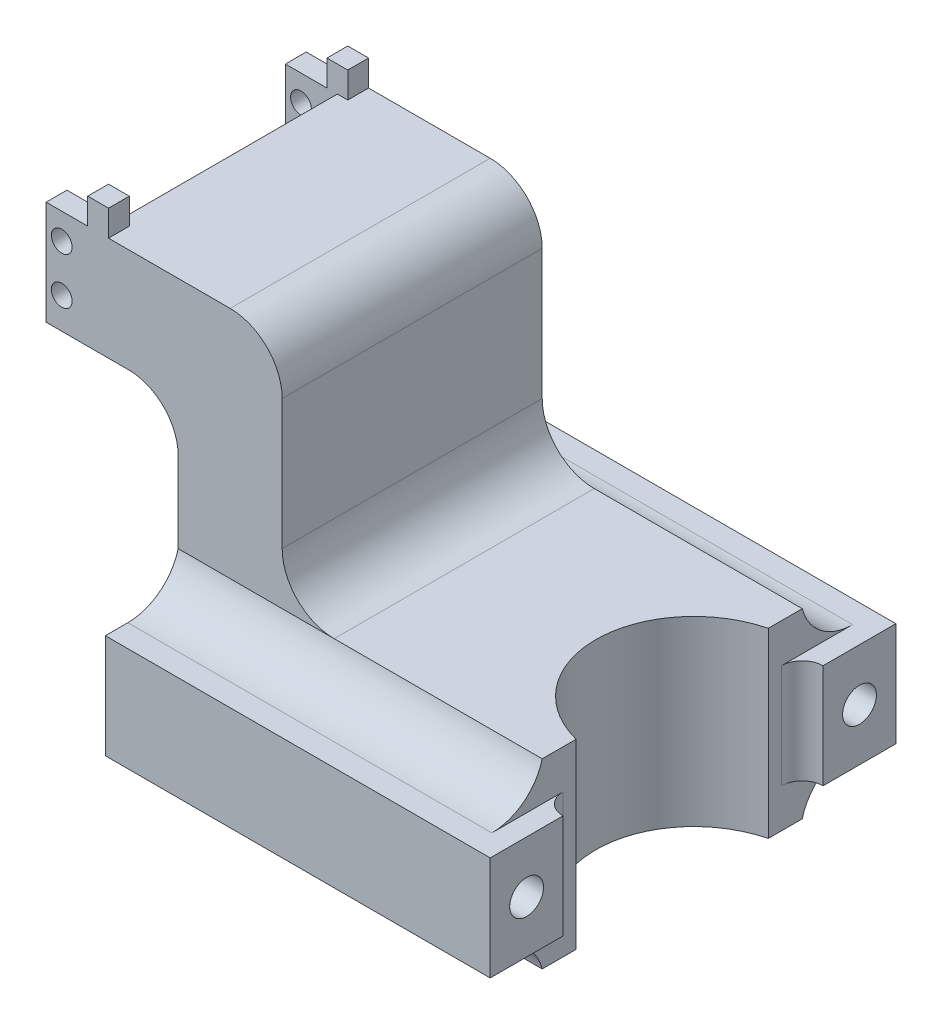
from build123d import *
from build123d.topology import SkipClean

# Parameters (mm, degrees)
SKETCH1_W                = 50
SKETCH1_H                = 50
SKETCH1_RX               = 19.7
SKETCH1_RY               = 19.1
BOSS_EXTRUDE1_DEPTH      = 35
SKETCH2_W                = 30
SKETCH2_H                = 50
CUT_EXTRUDE1_DEPTH       = 35
SKETCH3_W                = 13
SKETCH3_H                = 50
BOSS_EXTRUDE2_DEPTH      = 20
SKETCH4_R                = 1.5
CUT_EXTRUDE2_DEPTH       = 64.639610377
SKETCH5_W                = 36.974567712
SKETCH5_H                = 20
CUT_EXTRUDE3_DEPTH       = 20
BOSS_EXTRUDE3_DEPTH      = 4
BOSS_EXTRUDE3_DEPTH_BACK = 20
SKETCH6_W                = 14
SKETCH6_H                = 20
SKETCH6_R                = 3.25
SKETCH7_R                = 5.3
SKETCH7_R_2              = 3
CUT_EXTRUDE4_DEPTH       = 6
SKETCH8_W                = 13
SKETCH8_H                = 13.025432288
CUT_EXTRUDE5_DEPTH       = 30
FILLET6_R                = 4
FILLET5_R                = 10
SKETCH9_R                = 5.3
BOSS_EXTRUDE4_DEPTH      = 50
SKETCH10_W               = 20
SKETCH10_H               = 50
BOSS_EXTRUDE5_DEPTH      = 45
FILLET7_R                = 10
SKETCH11_W               = 50
SKETCH11_H               = 20
BOSS_EXTRUDE6_DEPTH      = 85
FILLET8_R                = 9.5
SKETCH13_R               = 37.5
BOSS_EXTRUDE7_DEPTH      = 20
CUT_EXTRUDE6_DEPTH       = 85
FILLET9_R                = 10
FILLET10_R               = 10
SKETCH14_R               = 3.25
CUT_EXTRUDE7_DEPTH       = 85
SKETCH15_R               = 5.3
CUT_EXTRUDE8_DEPTH       = 7
SKETCH16_R               = 3.25
BOSS_EXTRUDE9_DEPTH      = 56
SKETCH16_3_R             = 3.25
CUT_EXTRUDE11_DEPTH      = 10
SKETCH17_W               = 75
SKETCH17_H               = 20
CUT_EXTRUDE12_DEPTH      = 69.613081
SKETCH19_W               = 50
SKETCH19_H               = 20
BOSS_EXTRUDE10_DEPTH     = 10
SKETCH20_W               = 42
SKETCH20_H               = 20
CUT_EXTRUDE14_DEPTH      = 10
CUT_EXTRUDE15_REACH      = 145.435
SKETCH21_R               = 2
SKETCH22_W               = 4
SKETCH22_H               = 4
BOSS_EXTRUDE11_DEPTH     = 5
SKETCH25_R               = 2.5
CUT_EXTRUDE16_DEPTH      = 3.81


# Some blends are built 0.0001 mm under size
with BuildPart() as part:
    # Sketch1 → Boss-Extrude1 (new body)
    with BuildSketch(Plane(origin=(0, 0, 0), x_dir=(1, 0, 0), z_dir=(0, 1, 0))):
        Rectangle(SKETCH1_W, SKETCH1_H)
        with Locations((0, 0)):
            Ellipse(SKETCH1_RX, SKETCH1_RY, mode=Mode.SUBTRACT)
    extrude(amount=BOSS_EXTRUDE1_DEPTH)

    # Sketch2 → Cut-Extrude1 (cut)
    with BuildSketch(Plane(origin=(0, 35, 0), x_dir=(1, 0, 0), z_dir=(0, 1, 0))):
        with Locations((10, 0)):
            Rectangle(SKETCH2_W, SKETCH2_H)
    extrude(amount=-CUT_EXTRUDE1_DEPTH, mode=Mode.SUBTRACT)

    # Sketch3 → Boss-Extrude2 (add)
    with BuildSketch(Plane(origin=(0, 35, 0), x_dir=(1, 0, 0), z_dir=(0, 1, 0))):
        with Locations((-18.5, 0)):
            Rectangle(SKETCH3_W, SKETCH3_H)
    extrude(amount=BOSS_EXTRUDE2_DEPTH)

    # Sketch4 → Cut-Extrude2 (cut, through all)
    with BuildSketch(Plane.ZY.offset(25)):
        with Locations((18.474567712, 50)):
            Circle(SKETCH4_R)
    extrude(amount=-CUT_EXTRUDE2_DEPTH, mode=Mode.SUBTRACT)

    # Sketch5 → Cut-Extrude3 (cut)
    with BuildSketch(Plane(origin=(-12, 55, -25), x_dir=(0, 0, 1), z_dir=(-1, 0, 0))):
        with Locations((18.487283856, -10)):
            Rectangle(SKETCH5_W, SKETCH5_H)
    extrude(amount=CUT_EXTRUDE3_DEPTH, mode=Mode.SUBTRACT)

    # Sketch6 → Boss-Extrude3 (add, two sides: drawn at the far end of the back side and taken through both)
    # profile 1 of 2: a face of its own
    with BuildSketch(Plane(origin=(-5, 0, 0), x_dir=(0, 0, -1), z_dir=(1, 0, 0)).offset(-BOSS_EXTRUDE3_DEPTH_BACK)):
        with Locations((-32, 17.5)):
            Rectangle(SKETCH6_W, SKETCH6_H)
        with Locations((-32, 17.5)):
            Circle(SKETCH6_R, mode=Mode.SUBTRACT)
    # profile 2 of 2: a face of its own
    with BuildSketch(Plane(origin=(-5, 0, 0), x_dir=(0, 0, -1), z_dir=(1, 0, 0)).offset(-BOSS_EXTRUDE3_DEPTH_BACK)):
        with Locations((32, 17.5)):
            Rectangle(SKETCH6_W, SKETCH6_H)
        with Locations((32, 17.5)):
            Circle(SKETCH6_R, mode=Mode.SUBTRACT)
    extrude(amount=BOSS_EXTRUDE3_DEPTH + BOSS_EXTRUDE3_DEPTH_BACK)

    # Sketch7 → Cut-Extrude4 (cut)
    with BuildSketch(Plane.ZY.offset(25)):
        with Locations((-32, 17.5)):
            Circle(SKETCH7_R)
        with Locations((32, 17.5)):
            Circle(SKETCH7_R)
        with Locations((18.474567712, 50)):
            Circle(SKETCH7_R_2)
    extrude(amount=-CUT_EXTRUDE4_DEPTH, mode=Mode.SUBTRACT)

    # Sketch8 → Cut-Extrude5 (cut)
    with BuildSketch(Plane(origin=(0, 35, 0), x_dir=(1, 0, 0), z_dir=(0, 1, 0))):
        with Locations((-18.5, -18.487283856)):
            Rectangle(SKETCH8_W, SKETCH8_H)
    extrude(amount=CUT_EXTRUDE5_DEPTH, mode=Mode.SUBTRACT)

    # Fillet6
    fillet6_edges = [part.edges().sort_by_distance(p)[0] for p in [
        (-5, 17.5, 25),
        (-5, 17.5, -25),
    ]]
    fillet(fillet6_edges, radius=FILLET6_R - 0.0001)  # a hair under: the kernel refuses the full size

    # Fillet5
    # the kernel refuses this fillet: 10 mm, written as the material it adds along each edge
    with BuildSketch(Plane(origin=(-5, 7.5, 25), x_dir=(0, -1, 0), z_dir=(-1, 0, 0))) as fillet5_piece_1:
        with BuildLine():
            CenterArc((10, 9.682458366), FILLET5_R, 180, 75.522487814)
            Line((0, 9.682458366), (0, 0))
            Line((0, 0), (7.5, 0))
        make_face()
    extrude(amount=20)
    with BuildSketch(Plane(origin=(-5, 27.5, 25), x_dir=(0, 0, 1), z_dir=(-1, 0, 0)), Plane(origin=(-5, 7.5, -25), x_dir=(0, 0, -1), z_dir=(-1, 0, 0))) as fillet5_piece_2:
        with BuildLine():
            CenterArc((9.682458366, 10), FILLET5_R, 194.477512186, 75.522487814)
            Line((0, 7.5), (0, 0))
            Line((0, 0), (9.682458366, 0))
        make_face()
    extrude(amount=20)
    with BuildSketch(Plane(origin=(-5, 27.5, -25), x_dir=(0, 0, -1), z_dir=(-1, 0, 0))) as fillet5_piece_3:
        with BuildLine():
            CenterArc((9.682458366, -10), FILLET5_R, 90, 75.522487814)
            Line((0, -7.5), (0, 0))
            Line((0, 0), (9.682458366, 0))
        make_face()
    extrude(amount=20)

    # Sketch9 → Boss-Extrude4 (add)
    with BuildSketch(Plane.ZY.offset(25)):
        with BuildLine():
            Line((39, 27.5), (34.682458366, 27.5))
            ThreePointArc((34.682458366, 27.5), (28.558734009, 29.59430585), (25, 35))
            Line((25, 35), (-25, 35))
            ThreePointArc((-25, 35), (-28.558734009, 29.59430585), (-34.682458366, 27.5))
            Line((-34.682458366, 27.5), (-39, 27.5))
            Line((-39, 27.5), (-39, 7.5))
            Line((-39, 7.5), (-34.682458366, 7.5))
            ThreePointArc((-34.682458366, 7.5), (-28.558734009, 5.40569415), (-25, 0))
            Line((-25, 0), (25, 0))
            ThreePointArc((25, 0), (28.558734009, 5.40569415), (34.682458366, 7.5))
            Line((34.682458366, 7.5), (39, 7.5))
            Line((39, 7.5), (39, 27.5))
        make_face()
        with Locations((32, 17.5)):
            Circle(SKETCH9_R, mode=Mode.SUBTRACT)
        with Locations((-32, 17.5)):
            Circle(SKETCH9_R, mode=Mode.SUBTRACT)
    extrude(amount=BOSS_EXTRUDE4_DEPTH)

    # Sketch10 → Boss-Extrude5 (add)
    with SkipClean():  # the faces are left unmerged after this step: merging them gives an invalid solid
        with BuildSketch(Plane(origin=(0, 35, 0), x_dir=(1, 0, 0), z_dir=(0, 1, 0))):
            with Locations((-65, 0)):
                Rectangle(SKETCH10_W, SKETCH10_H)
        extrude(amount=BOSS_EXTRUDE5_DEPTH)

    # Fillet7
    fillet7_edges = [part.edges().sort_by_distance(p)[0] for p in [
        (-55, 35, 0),
    ]]
    fillet(fillet7_edges, radius=FILLET7_R)

    # Sketch11 → Boss-Extrude6 (add)
    with SkipClean():  # the faces are left unmerged after this step: merging them gives an invalid solid
        with BuildSketch(Plane.ZY.offset(75)):
            with Locations((0, 70)):
                Rectangle(SKETCH11_W, SKETCH11_H)
        extrude(amount=BOSS_EXTRUDE6_DEPTH)

    # Fillet8
    fillet8_edges = [part.edges().sort_by_distance(p)[0] for p in [
        (-75, 60, 0),
    ]]
    fillet(fillet8_edges, radius=FILLET8_R)

    # Sketch13 → Boss-Extrude7 (add)
    with SkipClean():  # the faces are left unmerged after this step: merging them gives an invalid solid
        with BuildSketch(Plane(origin=(0, 80, 0), x_dir=(1, 0, 0), z_dir=(0, 1, 0))):
            with Locations((-122.5, 0)):
                Circle(SKETCH13_R)
        extrude(amount=-BOSS_EXTRUDE7_DEPTH)

    # Sketch13<3> → Cut-Extrude6 (cut)
    with SkipClean():  # the faces are left unmerged after this step: merging them gives an invalid solid
        with BuildSketch(Plane(origin=(0, 80, 0), x_dir=(1, 0, 0), z_dir=(0, 1, 0))):
            with BuildLine():
                ThreePointArc((-150.450849719, -25), (-157.531463446, -13.380828406), (-160, -8.4e-08))
                Line((-160, -8.4e-08), (-160, -25))
                Line((-160, -25), (-150.450849719, -25))
            make_face()
            with BuildLine():
                Line((-150.450849719, 25), (-160, 25))
                Line((-160, 25), (-160, -8.4e-08))
                ThreePointArc((-160, -8.4e-08), (-157.531463476, 13.380828327), (-150.450849719, 25))
            make_face()
        extrude(amount=-CUT_EXTRUDE6_DEPTH, mode=Mode.SUBTRACT)

    # Fillet9
    fillet9_edges = [part.edges().sort_by_distance(p)[0] for p in [
        (-94.549150281, 70, 25),
        (-94.549150281, 70, -25),
    ]]
    fillet(fillet9_edges, radius=FILLET9_R)

    # Fillet10
    fillet10_edges = [part.edges().sort_by_distance(p)[0] for p in [
        (-55, 80, 0),
    ]]
    fillet(fillet10_edges, radius=FILLET10_R)

    # Sketch14 → Cut-Extrude7 (cut)
    with SkipClean():  # the faces are left unmerged after this step: merging them gives an invalid solid
        with BuildSketch(Plane(origin=(0, 80, 0), x_dir=(1, 0, 0), z_dir=(0, 1, 0))):
            with Locations(Location((-140.17766953, 17.67766953, 0), (0, 0, 270))):
                Circle(SKETCH14_R)
            with Locations(Location((-140.17766953, -17.67766953, 0), (0, 0, 270))):
                Circle(SKETCH14_R)
            with Locations(Location((-104.82233047, -17.67766953, 0), (0, 0, 270))):
                Circle(SKETCH14_R)
            with Locations(Location((-104.82233047, 17.67766953, 0), (0, 0, 270))):
                Circle(SKETCH14_R)
        extrude(amount=-CUT_EXTRUDE7_DEPTH, mode=Mode.SUBTRACT)

    # Sketch15 → Cut-Extrude8 (cut)
    with SkipClean():  # the faces are left unmerged after this step: merging them gives an invalid solid
        with BuildSketch(Plane(origin=(0, 80, 0), x_dir=(1, 0, 0), z_dir=(0, 1, 0))):
            with Locations(Location((-140.17766953, 17.67766953, 0), (0, 0, 270))):
                Circle(SKETCH15_R)
            with Locations(Location((-140.17766953, -17.67766953, 0), (0, 0, 270))):
                Circle(SKETCH15_R)
            with Locations(Location((-104.82233047, -17.67766953, 0), (0, 0, 270))):
                Circle(SKETCH15_R)
            with Locations(Location((-104.82233047, 17.67766953, 0), (0, 0, 270))):
                Circle(SKETCH15_R)
        extrude(amount=-CUT_EXTRUDE8_DEPTH, mode=Mode.SUBTRACT)

    # Sketch16 → Boss-Extrude9 (add)
    # profile 1 of 2: a face of its own
    with SkipClean():  # the faces are left unmerged after this step: merging them gives an invalid solid
        with BuildSketch(Plane.ZY.offset(75)):
            Polygon((-25.937822174, 17.5), (-28.968911087, 22.75), (-35.031088913, 22.75), (-38.062177826, 17.5), (-35.031088913, 12.25), (-28.968911087, 12.25), align=None)
            with Locations(Location((-32, 17.5, 0), (0, 0, 180))):
                Circle(SKETCH16_R, mode=Mode.SUBTRACT)
        # profile 2 of 2: a face of its own
        with BuildSketch(Plane.ZY.offset(75)):
            Polygon((25.937822174, 17.5), (28.968911087, 12.25), (35.031088913, 12.25), (38.062177826, 17.5), (35.031088913, 22.75), (28.968911087, 22.75), align=None)
            with Locations(Location((32, 17.5, 0), (0, 0, 180))):
                Circle(SKETCH16_R, mode=Mode.SUBTRACT)
        extrude(amount=-BOSS_EXTRUDE9_DEPTH)

    # Sketch16<3> → Cut-Extrude11 (cut)
    # profile 1 of 2: a face of its own
    with SkipClean():  # the faces are left unmerged after this step: merging them gives an invalid solid
        with BuildSketch(Plane.ZY.offset(75)):
            Polygon((-25.937822174, 17.5), (-28.968911087, 22.75), (-35.031088913, 22.75), (-38.062177826, 17.5), (-35.031088913, 12.25), (-28.968911087, 12.25), align=None)
            with Locations(Location((-32, 17.5, 0), (0, 0, 180))):
                Circle(SKETCH16_3_R, mode=Mode.SUBTRACT)
        # profile 2 of 2: a face of its own
        with BuildSketch(Plane.ZY.offset(75)):
            Polygon((25.937822174, 17.5), (28.968911087, 12.25), (35.031088913, 12.25), (38.062177826, 17.5), (35.031088913, 22.75), (28.968911087, 22.75), align=None)
            with Locations(Location((32, 17.5, 0), (0, 0, 180))):
                Circle(SKETCH16_3_R, mode=Mode.SUBTRACT)
        extrude(amount=-CUT_EXTRUDE11_DEPTH, mode=Mode.SUBTRACT)

    # Sketch17 → Cut-Extrude12 (cut)
    with SkipClean():  # the faces are left unmerged after this step: merging them gives an invalid solid
        with BuildSketch(Plane.ZY.offset(160)):
            with Locations((0, 70)):
                Rectangle(SKETCH17_W, SKETCH17_H)
        extrude(amount=-CUT_EXTRUDE12_DEPTH, mode=Mode.SUBTRACT)

    # Sketch19 → Boss-Extrude10 (add)
    with SkipClean():  # the faces are left unmerged after this step: merging them gives an invalid solid
        with BuildSketch(Plane.ZY.offset(90.386918553)):
            with Locations((0, 70)):
                Rectangle(SKETCH19_W, SKETCH19_H)
        extrude(amount=BOSS_EXTRUDE10_DEPTH)

    # Sketch20 → Cut-Extrude14 (cut)
    with SkipClean():  # the faces are left unmerged after this step: merging them gives an invalid solid
        with BuildSketch(Plane.ZY.offset(100.386918553)):
            with Locations((0, 70)):
                Rectangle(SKETCH20_W, SKETCH20_H)
        extrude(amount=-CUT_EXTRUDE14_DEPTH, mode=Mode.SUBTRACT)

    # Cut-Extrude15: up to this face of the body (flat: up to its plane)
    cut_extrude15_end = Plane(part.part.faces().sort_by_distance((-64.8934774, 56.533513417, 25))[0])
    # Sketch21 → Cut-Extrude15 (cut, up to the picked face)
    with BuildSketch(Plane(origin=(0, 0, -25), x_dir=(-1, 0, 0), z_dir=(0, 0, -1)), mode=Mode.PRIVATE) as cut_extrude15_sk1:
        with Locations((97.386918553, 75)):
            Circle(SKETCH21_R)
    cut_extrude15_tool1 = split(extrude(cut_extrude15_sk1.sketch, amount=-CUT_EXTRUDE15_REACH, mode=Mode.PRIVATE), bisect_by=cut_extrude15_end, keep=Keep.BOTH, mode=Mode.PRIVATE)
    # Sketch21 → Cut-Extrude15 (cut, up to the picked face)
    with BuildSketch(Plane(origin=(0, 0, -25), x_dir=(-1, 0, 0), z_dir=(0, 0, -1)), mode=Mode.PRIVATE) as cut_extrude15_sk2:
        with Locations((97.386918553, 66)):
            Circle(SKETCH21_R)
    cut_extrude15_tool2 = split(extrude(cut_extrude15_sk2.sketch, amount=-CUT_EXTRUDE15_REACH, mode=Mode.PRIVATE), bisect_by=cut_extrude15_end, keep=Keep.BOTH, mode=Mode.PRIVATE)
    add(cut_extrude15_tool1.solids().sort_by(Axis((-97.386919, 75, -25), (0, 0, 1)))[0], mode=Mode.SUBTRACT)
    add(cut_extrude15_tool2.solids().sort_by(Axis((-97.386919, 66, -25), (0, 0, 1)))[0], mode=Mode.SUBTRACT)

    # Sketch22 → Boss-Extrude11 (add)
    with SkipClean():  # the faces are left unmerged after this step: merging them gives an invalid solid
        with BuildSketch(Plane(origin=(0, 80, 0), x_dir=(1, 0, 0), z_dir=(0, 1, 0))):
            with Locations((-90.386918553, 23)):
                Rectangle(SKETCH22_W, SKETCH22_H)
            with Locations((-90.386918553, -23)):
                Rectangle(SKETCH22_W, SKETCH22_H)
        extrude(amount=BOSS_EXTRUDE11_DEPTH)

    # Sketch25 → Cut-Extrude16 (cut)
    with SkipClean():  # the faces are left unmerged after this step: merging them gives an invalid solid
        with BuildSketch(Plane.XZ):
            with Locations(Location((-40, 17.5, 0), (0, 0, 270))):
                Circle(SKETCH25_R)
            with Locations(Location((-40, -17.5, 0), (0, 0, 270))):
                Circle(SKETCH25_R)
        extrude(amount=-CUT_EXTRUDE16_DEPTH, mode=Mode.SUBTRACT)


solid = part.part
